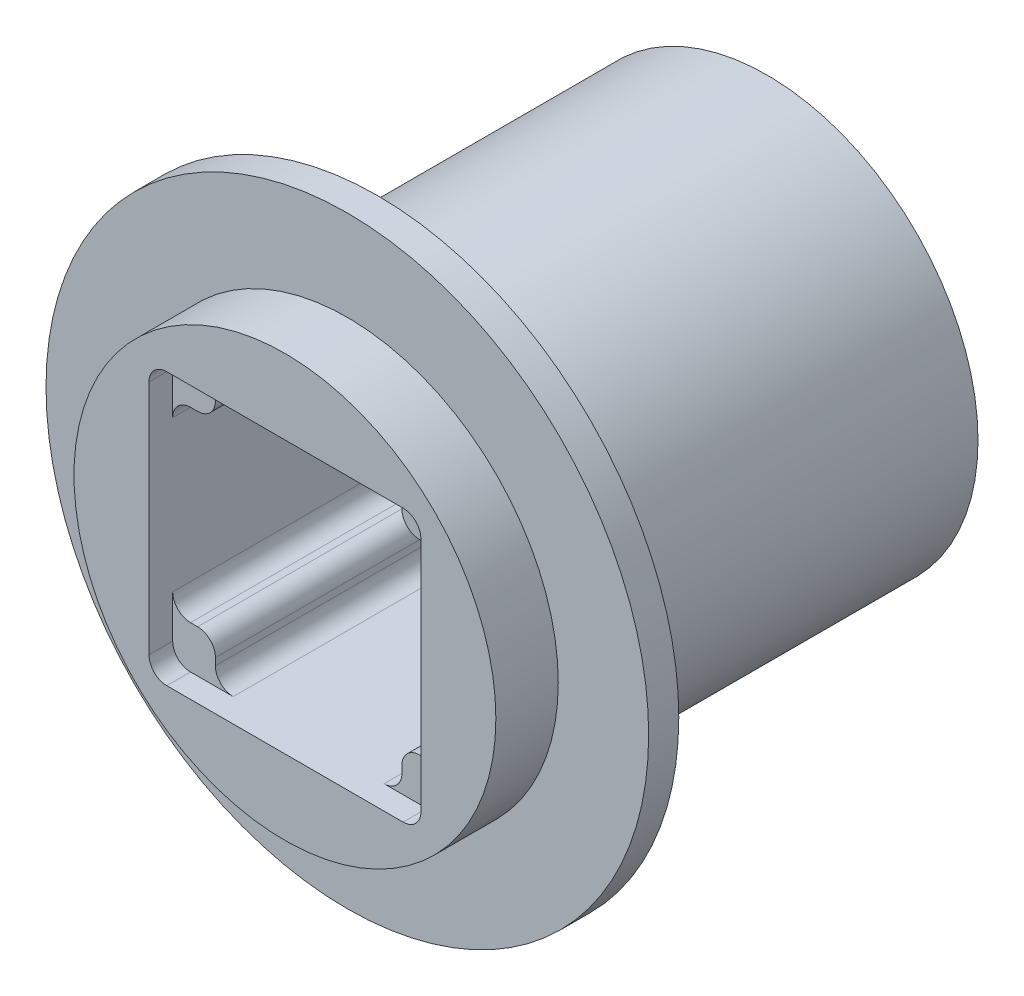
from build123d import *

# Parameters (mm, degrees)
SKETCH1_R           = 63.5
BOSS_EXTRUDE1_DEPTH = 6.35
BOSS_EXTRUDE2_START = 19.5
SKETCH1_3_R         = 44.45
BOSS_EXTRUDE2_DEPTH = 101.6
CUT_EXTRUDE1_DEPTH  = 136.598893801
FILLET1_R           = 3.75
CUT_EXTRUDE2_DEPTH  = 5


with BuildPart() as part:
    # Sketch1 → Boss-Extrude1 (new body)
    with BuildSketch(Plane.XY):
        Circle(SKETCH1_R)
    extrude(amount=BOSS_EXTRUDE1_DEPTH)

    # Sketch1<3> → Boss-Extrude2 (add)
    with BuildSketch(Plane.XY.offset(BOSS_EXTRUDE2_START)):
        Circle(SKETCH1_3_R)
    extrude(amount=-BOSS_EXTRUDE2_DEPTH)

    # Sketch2 → Cut-Extrude1 (cut, through all)
    with BuildSketch(Plane(origin=(0, 0, 19.5), x_dir=(-1, 0, 0), z_dir=(0, 0, -1))):
        Polygon((-19.65, 28.65), (-19.65, 19.65), (-28.65, 19.65), (-28.65, -19.65), (-19.65, -19.65), (-19.65, -28.65), (19.65, -28.65), (19.65, -19.65), (28.65, -19.65), (28.65, 19.65), (19.65, 19.65), (19.65, 28.65), align=None)
    extrude(amount=CUT_EXTRUDE1_DEPTH, mode=Mode.SUBTRACT)

    # Fillet1
    fillet1_edges = [part.edges().sort_by_distance(p)[0] for p in [
        (19.65, -19.65, -31.3),
        (-19.65, -19.65, -31.3),
        (-19.65, 19.65, -31.3),
        (19.65, 19.65, -31.3),
        (-28.65, 19.65, -31.3),
        (-19.65, -28.65, -31.3),
        (19.65, -28.65, -31.3),
        (28.65, -19.65, -31.3),
        (28.65, 19.65, -31.3),
        (19.65, 28.65, -31.3),
        (-19.65, 28.65, -31.3),
        (-28.65, -19.65, -31.3),
    ]]
    fillet(fillet1_edges, radius=FILLET1_R)

    # Sketch3 → Cut-Extrude2 (cut)
    with BuildSketch(Plane(origin=(0, 0, 19.5), x_dir=(-1, 0, 0), z_dir=(0, 0, -1))):
        with BuildLine():
            Line((-24.9, -28.65), (24.9, -28.65))
            ThreePointArc((24.9, -28.65), (27.551650429, -27.551650429), (28.65, -24.9))
            Line((28.65, -24.9), (28.65, 24.9))
            ThreePointArc((28.65, 24.9), (27.551650429, 27.551650429), (24.9, 28.65))
            Line((24.9, 28.65), (-24.9, 28.65))
            ThreePointArc((-24.9, 28.65), (-27.551650429, 27.551650429), (-28.65, 24.9))
            Line((-28.65, 24.9), (-28.65, -24.9))
            ThreePointArc((-28.65, -24.9), (-27.551650429, -27.551650429), (-24.9, -28.65))
        make_face()
    extrude(amount=CUT_EXTRUDE2_DEPTH, mode=Mode.SUBTRACT)


solid = part.part
